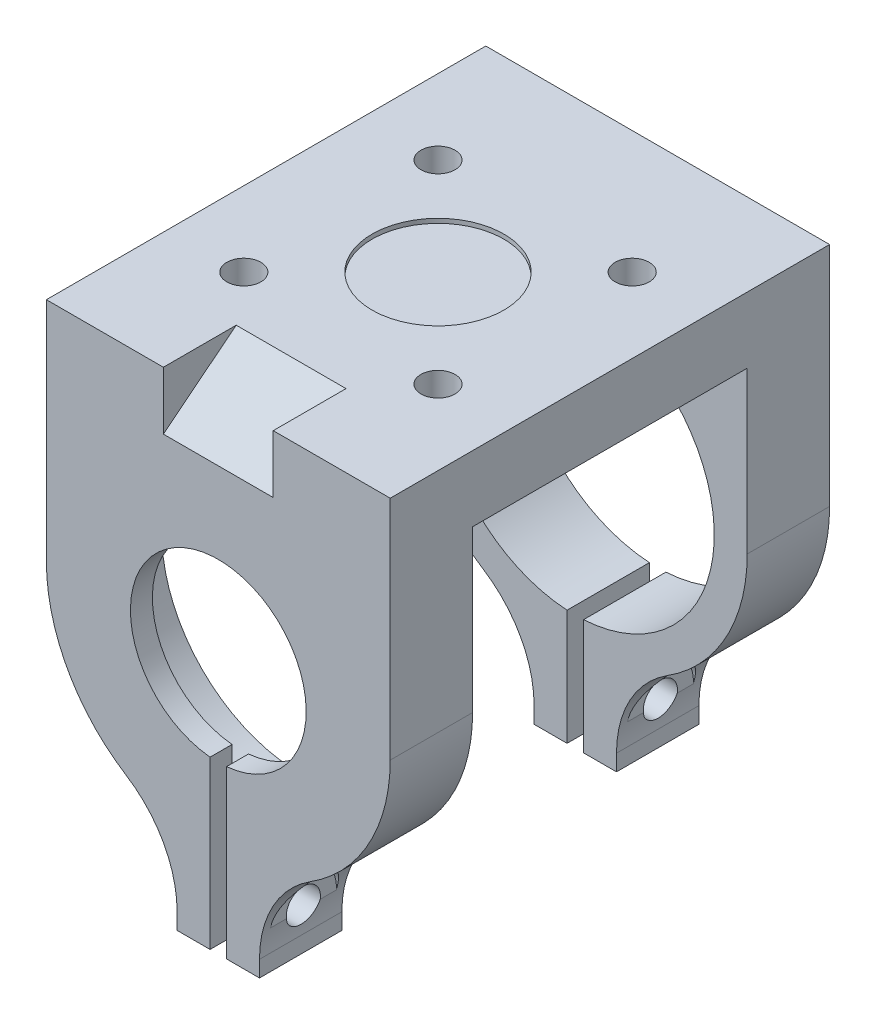
from build123d import *

# Parameters (mm, degrees)
BOSS_EXTRUDE1_DEPTH   = 20
SKETCH2_W             = 3
SKETCH2_H             = 10.5
BOSS_EXTRUDE2_DEPTH   = 20
SKETCH4_W             = 31.3
SKETCH4_H             = 40
BOSS_EXTRUDE3_DEPTH   = 5
SKETCH5_W             = 25
SKETCH5_H             = 37.777747226
CUT_EXTRUDE2_DEPTH    = 13.65
SKETCH6_R             = 1.55
MOTORMOUNTHOLES_DEPTH = 6
CLAMPHOLES_REACH      = 38.211
SKETCH8_R             = 1.55
ENDSTOPPER_DEPTH      = 2
CUT_EXTRUDE7_START    = -15.65
SKETCH10_W            = 25
SKETCH10_H            = 37.777747226
CUT_EXTRUDE7_DEPTH    = 13.65
SKETCH11_W            = 25
SKETCH11_H            = 10.636850541
CUT_EXTRUDE8_DEPTH    = 4
FILLET1_START         = -20
FILLET1_DEPTH         = 2.1999999
FILLET1_START_2       = -14.6999999
FILLET1_2_DEPTH       = 2.1999999
FILLET1_START_3       = 12.5
FILLET1_3_DEPTH       = 2.1999999
FILLET1_START_4       = 17.8000001
FILLET1_4_DEPTH       = 2.1999999
FILLET1_START_5       = -17.8000001
FILLET1_5_DEPTH       = 3.1000002
FILLET1_START_6       = 14.6999999
FILLET1_6_DEPTH       = 3.1000002
FILLET1_START_7       = -8.389376218
FILLET1_7_OUTLINE_R   = 1.55
FILLET1_7_DEPTH       = 16.778752436
SKETCH13_W            = 10
SKETCH13_H            = 10
CUT_EXTRUDE10_REACH   = 40.348
CUT_EXTRUDE10_START   = 4
SKETCH15_R            = 3
CUT_EXTRUDE11_START   = -4
CUT_EXTRUDE11_DEPTH   = 3
SKETCH17_R            = 6
SHAFT_CLEARANCE_DEPTH = 0.4


with BuildPart() as part:
    # Sketch1 → Boss-Extrude1 (new, symmetric)
    with BuildSketch(Plane.XY):
        with BuildLine():
            Line((-15.65, 15.65), (-15.65, 0))
            ThreePointArc((-15.65, 0), (-11.066221106, 11.066221145), (5.4e-08, 15.65))
            Line((5.4e-08, 15.65), (-15.65, 15.65))
        make_face()
        with BuildLine():
            Line((15.65, 15.65), (5.4e-08, 15.65))
            ThreePointArc((5.4e-08, 15.65), (11.066221145, 11.066221106), (15.65, 0))
            Line((15.65, 0), (15.65, 15.65))
        make_face()
        with BuildLine():
            ThreePointArc((5.4e-08, 15.65), (-11.066221106, 11.066221145), (-15.65, 0))
            ThreePointArc((-15.65, 0), (-11.328283189, -10.797800702), (-0.75, -15.632018424))
            Line((-0.75, -15.632018424), (-0.75, -12.627747226))
            ThreePointArc((-0.75, -12.627747226), (-8.675684411, 9.206247878), (12.65, 0))
            ThreePointArc((12.65, 0), (9.206247878, -8.675684411), (0.75, -12.627747226))
            Line((0.75, -12.627747226), (0.75, -15.632018424))
            ThreePointArc((0.75, -15.632018424), (11.328283189, -10.797800702), (15.65, 0))
            ThreePointArc((15.65, 0), (11.066221145, 11.066221106), (5.4e-08, 15.65))
        make_face()
    extrude(amount=BOSS_EXTRUDE1_DEPTH, both=True)

    # Sketch2 → Boss-Extrude2 (add, symmetric)
    with BuildSketch(Plane.XY):
        with Locations((-2.25, -17.877747226)):
            Rectangle(SKETCH2_W, SKETCH2_H)
        with Locations((2.25, -17.877747226)):
            Rectangle(SKETCH2_W, SKETCH2_H)
    extrude(amount=BOSS_EXTRUDE2_DEPTH, both=True)

    # Sketch4 → Boss-Extrude3 (add)
    with BuildSketch(Plane(origin=(0, 15.65, 0), x_dir=(1, 0, 0), z_dir=(0, 1, 0))):
        Rectangle(SKETCH4_W, SKETCH4_H)
    extrude(amount=BOSS_EXTRUDE3_DEPTH)

    # Sketch5 → Cut-Extrude2 (cut)
    with BuildSketch(Plane(origin=(15.65, 0, 0), x_dir=(0, 0, -1), z_dir=(1, 0, 0))):
        with Locations((0, -4.238873613)):
            Rectangle(SKETCH5_W, SKETCH5_H)
    extrude(amount=-CUT_EXTRUDE2_DEPTH, mode=Mode.SUBTRACT)

    # Sketch6 → MotorMountHoles (cut)
    with BuildSketch(Plane(origin=(0, 20.65, 0), x_dir=(1, 0, 0), z_dir=(0, 1, 0))):
        with Locations(Location((-8.838834765, 8.838834765, 0), (0, 0, 270))):
            Circle(SKETCH6_R)
        with Locations(Location((8.838834765, 8.838834765, 0), (0, 0, 270))):
            Circle(SKETCH6_R)
        with Locations(Location((8.838834765, -8.838834765, 0), (0, 0, 270))):
            Circle(SKETCH6_R)
        with Locations(Location((-8.838834765, -8.838834765, 0), (0, 0, 270))):
            Circle(SKETCH6_R)
    extrude(amount=-MOTORMOUNTHOLES_DEPTH, mode=Mode.SUBTRACT)

    # ClampHoles: up to this face of the body (flat: up to its plane)
    clampholes_end = Plane(part.part.faces().sort_by_distance((3.75, -19.16091251, 16.25))[0])
    # Sketch8 → ClampHoles (cut, up to the picked face)
    with BuildSketch(Plane.ZY.offset(3.75), mode=Mode.PRIVATE) as clampholes_sk1:
        with Locations(Location((16.25, -19.194077794, 0), (0, 0, 270))):
            Circle(SKETCH8_R)
    clampholes_tool1 = split(extrude(clampholes_sk1.sketch, amount=-CLAMPHOLES_REACH, mode=Mode.PRIVATE), bisect_by=clampholes_end, keep=Keep.BOTH, mode=Mode.PRIVATE)
    # Sketch8 → ClampHoles (cut, up to the picked face)
    with BuildSketch(Plane.ZY.offset(3.75), mode=Mode.PRIVATE) as clampholes_sk2:
        with Locations(Location((-16.25, -19.194077794, 0), (0, 0, 270))):
            Circle(SKETCH8_R)
    clampholes_tool2 = split(extrude(clampholes_sk2.sketch, amount=-CLAMPHOLES_REACH, mode=Mode.PRIVATE), bisect_by=clampholes_end, keep=Keep.BOTH, mode=Mode.PRIVATE)
    add(clampholes_tool1.solids().sort_by(Axis((-3.75, -19.194078, 16.25), (1, 0, 0)))[0], mode=Mode.SUBTRACT)
    add(clampholes_tool2.solids().sort_by(Axis((-3.75, -19.194078, -16.25), (1, 0, 0)))[0], mode=Mode.SUBTRACT)

    # Sketch9 → EndStopper (add)
    with BuildSketch(Plane.XY.offset(20)):
        with BuildLine():
            ThreePointArc((12.65, 0), (-8.675684411, 9.206247878), (-0.75, -12.627747226))
            Line((-0.75, -12.627747226), (-0.75, -7.964766161))
            ThreePointArc((-0.75, -7.964766161), (-5.385164807, 5.916079783), (8, 0))
            ThreePointArc((8, 0), (5.916079783, -5.385164807), (0.75, -7.964766161))
            Line((0.75, -7.964766161), (0.75, -12.627747226))
            ThreePointArc((0.75, -12.627747226), (9.206247878, -8.675684411), (12.65, 0))
        make_face()
    extrude(amount=-ENDSTOPPER_DEPTH)

    # Sketch10 → Cut-Extrude7 (cut)
    with BuildSketch(Plane(origin=(0, 0, 0), x_dir=(0, 0, -1), z_dir=(1, 0, 0)).offset(CUT_EXTRUDE7_START)):
        with Locations((0, -4.238873613)):
            Rectangle(SKETCH10_W, SKETCH10_H)
    extrude(amount=CUT_EXTRUDE7_DEPTH, mode=Mode.SUBTRACT)

    # Sketch11 → Cut-Extrude8 (cut)
    with BuildSketch(Plane.ZY.offset(2)):
        with Locations((0, -17.809321955)):
            Rectangle(SKETCH11_W, SKETCH11_H)
    extrude(amount=-CUT_EXTRUDE8_DEPTH, mode=Mode.SUBTRACT)

    # Fillet1: read off the stored shape, not the designer's step
    # Fillet1 outline → Fillet1 (add)
    with BuildSketch(Plane.XY.offset(FILLET1_START)):
        with BuildLine():
            Line((3.75, -15.194077794), (3.75, -21.653175287))
            ThreePointArc((3.75, -21.653175287), (4.986261134, -16.83686123), (8.389376218, -13.211391549))
            ThreePointArc((8.389376218, -13.211391549), (6.150111782, -14.39092162), (3.75, -15.194077794))
        make_face()
        with BuildLine():
            ThreePointArc((-3.75, -15.194077794), (-6.150111782, -14.39092162), (-8.389376218, -13.21139155))
            ThreePointArc((-8.389376218, -13.21139155), (-4.986261134, -16.83686123), (-3.75, -21.653175287))
            Line((-3.75, -21.653175287), (-3.75, -15.194077794))
        make_face()
    extrude(amount=FILLET1_DEPTH)

    # Fillet1 2 outline → Fillet1 2 (add)
    with BuildSketch(Plane.XY.offset(FILLET1_START_2)):
        with BuildLine():
            Line((3.75, -15.194077794), (3.75, -21.653175287))
            ThreePointArc((3.75, -21.653175287), (4.986261134, -16.83686123), (8.389376218, -13.211391549))
            ThreePointArc((8.389376218, -13.211391549), (6.150111782, -14.39092162), (3.75, -15.194077794))
        make_face()
        with BuildLine():
            ThreePointArc((-3.75, -15.194077794), (-6.150111782, -14.39092162), (-8.389376218, -13.21139155))
            ThreePointArc((-8.389376218, -13.21139155), (-4.986261134, -16.83686123), (-3.75, -21.653175287))
            Line((-3.75, -21.653175287), (-3.75, -15.194077794))
        make_face()
    extrude(amount=FILLET1_2_DEPTH)

    # Fillet1 3 outline → Fillet1 3 (add)
    with BuildSketch(Plane.XY.offset(FILLET1_START_3)):
        with BuildLine():
            Line((3.75, -15.194077794), (3.75, -21.653175287))
            ThreePointArc((3.75, -21.653175287), (4.986261134, -16.83686123), (8.389376218, -13.211391549))
            ThreePointArc((8.389376218, -13.211391549), (6.150111782, -14.39092162), (3.75, -15.194077794))
        make_face()
        with BuildLine():
            ThreePointArc((-3.75, -15.194077794), (-6.150111782, -14.39092162), (-8.389376218, -13.21139155))
            ThreePointArc((-8.389376218, -13.21139155), (-4.986261134, -16.83686123), (-3.75, -21.653175287))
            Line((-3.75, -21.653175287), (-3.75, -15.194077794))
        make_face()
    extrude(amount=FILLET1_3_DEPTH)

    # Fillet1 4 outline → Fillet1 4 (add)
    with BuildSketch(Plane.XY.offset(FILLET1_START_4)):
        with BuildLine():
            Line((3.75, -15.194077794), (3.75, -21.653175287))
            ThreePointArc((3.75, -21.653175287), (4.986261134, -16.83686123), (8.389376218, -13.211391549))
            ThreePointArc((8.389376218, -13.211391549), (6.150111782, -14.39092162), (3.75, -15.194077794))
        make_face()
        with BuildLine():
            ThreePointArc((-3.75, -15.194077794), (-6.150111782, -14.39092162), (-8.389376218, -13.21139155))
            ThreePointArc((-8.389376218, -13.21139155), (-4.986261134, -16.83686123), (-3.75, -21.653175287))
            Line((-3.75, -21.653175287), (-3.75, -15.194077794))
        make_face()
    extrude(amount=FILLET1_4_DEPTH)

    # Fillet1 5 outline → Fillet1 5 (add)
    with BuildSketch(Plane.XY.offset(FILLET1_START_5)):
        with BuildLine():
            Line((3.75, -15.194077794), (3.75, -21.653175287))
            ThreePointArc((3.75, -21.653175287), (4.986261134, -16.83686123), (8.389376218, -13.211391549))
            ThreePointArc((8.389376218, -13.211391549), (6.150111782, -14.39092162), (3.75, -15.194077794))
        make_face()
        with BuildLine():
            ThreePointArc((-3.75, -15.194077794), (-6.150111782, -14.39092162), (-8.389376218, -13.21139155))
            ThreePointArc((-8.389376218, -13.21139155), (-4.986261134, -16.83686123), (-3.75, -21.653175287))
            Line((-3.75, -21.653175287), (-3.75, -15.194077794))
        make_face()
    extrude(amount=FILLET1_5_DEPTH)

    # Fillet1 6 outline → Fillet1 6 (add)
    with BuildSketch(Plane.XY.offset(FILLET1_START_6)):
        with BuildLine():
            Line((3.75, -15.194077794), (3.75, -21.653175287))
            ThreePointArc((3.75, -21.653175287), (4.986261134, -16.83686123), (8.389376218, -13.211391549))
            ThreePointArc((8.389376218, -13.211391549), (6.150111782, -14.39092162), (3.75, -15.194077794))
        make_face()
        with BuildLine():
            ThreePointArc((-3.75, -15.194077794), (-6.150111782, -14.39092162), (-8.389376218, -13.21139155))
            ThreePointArc((-8.389376218, -13.21139155), (-4.986261134, -16.83686123), (-3.75, -21.653175287))
            Line((-3.75, -21.653175287), (-3.75, -15.194077794))
        make_face()
    extrude(amount=FILLET1_6_DEPTH)

    # Fillet1 7 outline → Fillet1 7 (cut)
    with BuildSketch(Plane.YZ.offset(FILLET1_START_7)):
        with Locations((-19.194077794, -16.25)):
            Circle(FILLET1_7_OUTLINE_R)
        with Locations((-19.194077794, 16.25)):
            Circle(FILLET1_7_OUTLINE_R)
    extrude(amount=FILLET1_7_DEPTH, mode=Mode.SUBTRACT)

    # Cut-Sweep1: sweep along a path in Sketch12
    with BuildLine(Plane(origin=(0, 0, 0), x_dir=(0, 0, -1), z_dir=(1, 0, 0))) as cut_sweep1_path:
        Line((-2.775739564, 34.353299637), (-30.459033802, 12.328988213))
    # Sketch13 → Cut-Sweep1 (sweep, cut)
    with BuildSketch(Plane(origin=(0, 11.963370534, -15.037269505), x_dir=(-1, 0, 0), z_dir=(0, 0.6225843191548198, -0.7825527238100508))):
        with Locations((0, 29.484397462)):
            Rectangle(SKETCH13_W, SKETCH13_H)
    sweep(path=cut_sweep1_path.line, mode=Mode.SUBTRACT)

    # Sketch15 → Cut-Extrude10 (cut, up to next)
    with BuildSketch(Plane(origin=(0, 0, 0), x_dir=(0, 0, -1), z_dir=(1, 0, 0)).offset(CUT_EXTRUDE10_START), mode=Mode.PRIVATE) as cut_extrude10_sk1:
        with Locations((16.25, -19.194077794)):
            Circle(SKETCH15_R)
    cut_extrude10_tool1 = extrude(cut_extrude10_sk1.sketch, amount=CUT_EXTRUDE10_REACH, mode=Mode.PRIVATE) & part.part
    cut_extrude10 = cut_extrude10_tool1.solids().sort_by_distance((4, -19.194078, -16.25))[0]
    add(cut_extrude10, mode=Mode.SUBTRACT)

    # Sketch16 → Cut-Extrude11 (cut)
    with BuildSketch(Plane(origin=(0, 0, 0), x_dir=(0, 0, -1), z_dir=(1, 0, 0)).offset(CUT_EXTRUDE11_START)):
        Polygon((12.959103466, -19.194077794), (14.604551733, -22.044077794), (17.895448267, -22.044077794), (19.540896534, -19.194077794), (17.895448267, -16.344077794), (14.604551733, -16.344077794), align=None)
    cut_extrude11 = extrude(amount=-CUT_EXTRUDE11_DEPTH, mode=Mode.SUBTRACT)

    # Mirror1: Cut-Extrude10, Cut-Extrude11 across plane
    add(cut_extrude10.mirror(Plane.XY), mode=Mode.SUBTRACT)
    add(cut_extrude11.mirror(Plane.XY), mode=Mode.SUBTRACT)

    # Sketch17 → Shaft Clearance (cut)
    with BuildSketch(Plane(origin=(0, 20.65, 0), x_dir=(1, 0, 0), z_dir=(0, 1, 0))):
        with Locations(Location((0, 0, 0), (0, 0, 270))):
            Circle(SKETCH17_R)
    extrude(amount=-SHAFT_CLEARANCE_DEPTH, mode=Mode.SUBTRACT)


solid = part.part
